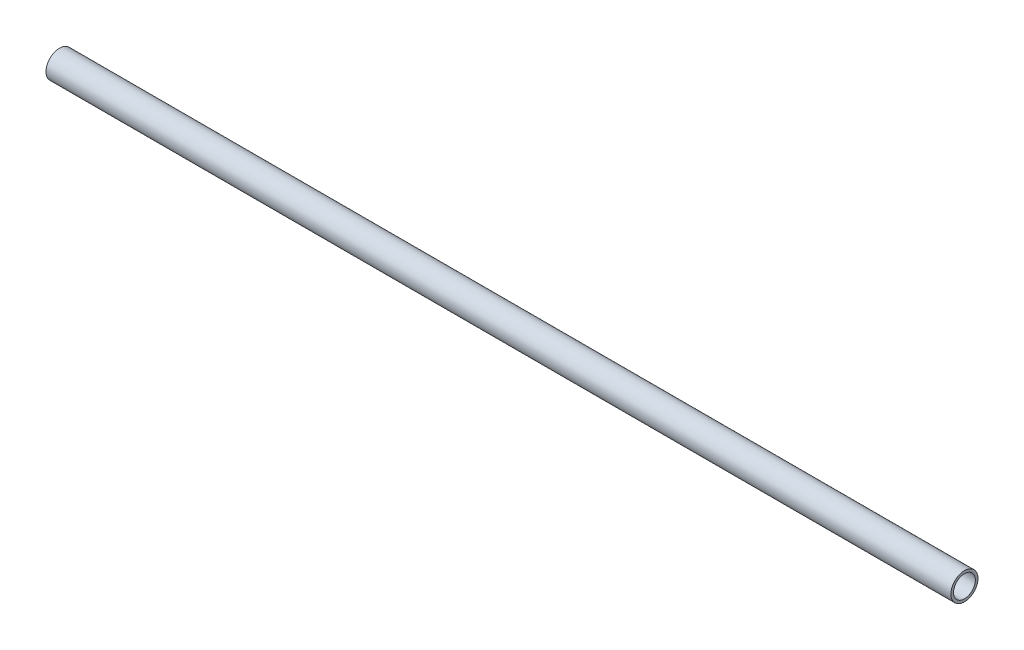
from build123d import *

# Parameters (mm, degrees)
SKETCH1_R           = 6.35
SKETCH1_R_2         = 5.1054
BOSS_EXTRUDE1_DEPTH = 424.12412


with BuildPart() as part:
    # Sketch1 → Boss-Extrude1 (new body)
    with BuildSketch(Plane(origin=(0, 0, 0), x_dir=(0, 0, -1), z_dir=(1, 0, 0))):
        Circle(SKETCH1_R)
        Circle(SKETCH1_R_2, mode=Mode.SUBTRACT)
    extrude(amount=BOSS_EXTRUDE1_DEPTH)


solid = part.part
